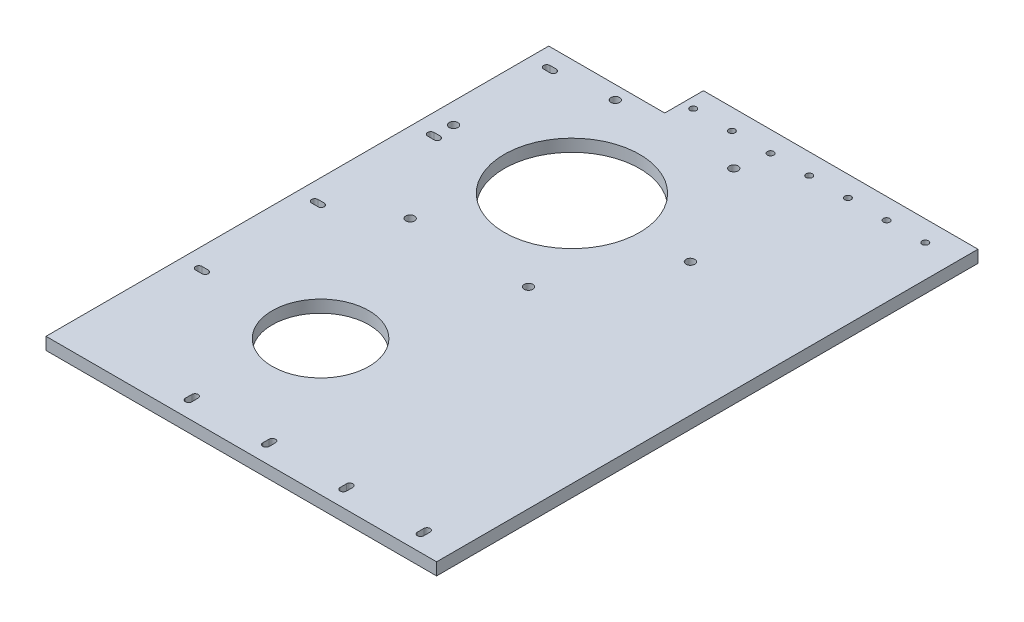
from build123d import *

# Parameters (mm, degrees)
BOSS_EXTRUDE1_DEPTH = 6.35
SKETCH9_R           = 1.65
CUT_EXTRUDE10_DEPTH = 30
CUT_EXTRUDE12_DEPTH = 30
CUT_EXTRUDE13_DEPTH = 10
SKETCH12_R          = 35
CUT_EXTRUDE14_DEPTH = 192.836707905
SKETCH13_R          = 2.25
CUT_EXTRUDE15_DEPTH = 192.836707905
SKETCH14_R          = 25
CUT_EXTRUDE16_DEPTH = 10


with BuildPart() as part:
    # Sketch1 → Boss-Extrude1 (new body)
    with BuildSketch(Plane(origin=(0, 0, 0), x_dir=(1, 0, 0), z_dir=(0, 1, 0))):
        Polygon((-71, 140), (71, 140), (71, -140), (-131, -140), (-131, 120), (-71, 120), align=None)
    extrude(amount=BOSS_EXTRUDE1_DEPTH)

    # Sketch9 → Cut-Extrude10 (cut)
    with BuildSketch(Plane(origin=(0, 0, 0), x_dir=(-1, 0, 0), z_dir=(0, -1, 0))):
        with Locations((45.6, 129.325)):
            Circle(SKETCH9_R)
        with Locations((5.6, 129.325)):
            Circle(SKETCH9_R)
        with Locations((-34.4, 129.325)):
            Circle(SKETCH9_R)
        with Locations((65.6, 129.325)):
            Circle(SKETCH9_R)
        with Locations((25.6, 129.325)):
            Circle(SKETCH9_R)
        with Locations((-14.4, 129.325)):
            Circle(SKETCH9_R)
        with Locations((-54.4, 129.325)):
            Circle(SKETCH9_R)
    extrude(amount=-CUT_EXTRUDE10_DEPTH, mode=Mode.SUBTRACT)

    # Sketch11 → Cut-Extrude12 (cut)
    with BuildSketch(Plane(origin=(0, 6.35, 0), x_dir=(1, 0, 0), z_dir=(0, 1, 0))):
        with BuildLine():
            Line((-63.95, -128.355), (-63.95, -131.655))
            ThreePointArc((-63.95, -131.655), (-65.6, -133.305), (-67.25, -131.655))
            Line((-67.25, -131.655), (-67.25, -128.355))
            ThreePointArc((-67.25, -128.355), (-65.6, -126.705), (-63.95, -128.355))
        make_face()
        with BuildLine():
            Line((-23.95, -128.353535871), (-23.95, -131.653535871))
            ThreePointArc((-23.95, -131.653535871), (-25.6, -133.303535871), (-27.25, -131.653535871))
            Line((-27.25, -131.653535871), (-27.25, -128.353535871))
            ThreePointArc((-27.25, -128.353535871), (-25.6, -126.703535871), (-23.95, -128.353535871))
        make_face()
        with BuildLine():
            Line((16.05, -128.352071742), (16.05, -131.652071742))
            ThreePointArc((16.05, -131.652071742), (14.4, -133.302071742), (12.75, -131.652071742))
            Line((12.75, -131.652071742), (12.75, -128.352071742))
            ThreePointArc((12.75, -128.352071742), (14.4, -126.702071742), (16.05, -128.352071742))
        make_face()
        with BuildLine():
            Line((56.05, -128.350607613), (56.05, -131.650607613))
            ThreePointArc((56.05, -131.650607613), (54.4, -133.300607613), (52.75, -131.650607613))
            Line((52.75, -131.650607613), (52.75, -128.350607613))
            ThreePointArc((52.75, -128.350607613), (54.4, -126.700607613), (56.05, -128.350607613))
        make_face()
    extrude(amount=-CUT_EXTRUDE12_DEPTH, mode=Mode.SUBTRACT)

    # Sketch10 → Cut-Extrude13 (cut)
    with BuildSketch(Plane.XZ):
        with BuildLine():
            ThreePointArc((-121.975, 11.65), (-123.625, 10), (-121.975, 8.35))
            Line((-121.975, 8.35), (-118.675, 8.35))
            ThreePointArc((-118.675, 8.35), (-117.025, 10), (-118.675, 11.65))
            Line((-118.675, 11.65), (-121.975, 11.65))
        make_face()
        with BuildLine():
            ThreePointArc((-121.975, 71.65), (-123.625, 70), (-121.975, 68.35))
            Line((-121.975, 68.35), (-118.675, 68.35))
            ThreePointArc((-118.675, 68.35), (-117.025, 70), (-118.675, 71.65))
            Line((-118.675, 71.65), (-121.975, 71.65))
        make_face()
        with BuildLine():
            ThreePointArc((-121.975, -48.35), (-123.625, -50), (-121.975, -51.65))
            Line((-121.975, -51.65), (-118.675, -51.65))
            ThreePointArc((-118.675, -51.65), (-117.025, -50), (-118.675, -48.35))
            Line((-118.675, -48.35), (-121.975, -48.35))
        make_face()
        with BuildLine():
            ThreePointArc((-121.975, -108.35), (-123.625, -110), (-121.975, -111.65))
            Line((-121.975, -111.65), (-118.675, -111.65))
            ThreePointArc((-118.675, -111.65), (-117.025, -110), (-118.675, -108.35))
            Line((-118.675, -108.35), (-121.975, -108.35))
        make_face()
    extrude(amount=-CUT_EXTRUDE13_DEPTH, mode=Mode.SUBTRACT)

    # Sketch12 → Cut-Extrude14 (cut, through all)
    with BuildSketch(Plane(origin=(0, 6.35, 0), x_dir=(1, 0, 0), z_dir=(0, 1, 0))):
        with Locations((-59, 60)):
            Circle(SKETCH12_R)
    extrude(amount=-CUT_EXTRUDE14_DEPTH, mode=Mode.SUBTRACT)

    # Sketch13 → Cut-Extrude15 (cut, through all)
    with BuildSketch(Plane(origin=(0, 6.35, 0), x_dir=(1, 0, 0), z_dir=(0, 1, 0))):
        with Locations((-120.25, 60)):
            Circle(SKETCH13_R)
        with Locations((-89.625, 113.044055982)):
            Circle(SKETCH13_R)
        with Locations((-28.375, 113.044055982)):
            Circle(SKETCH13_R)
        with Locations((2.25, 60)):
            Circle(SKETCH13_R)
        with Locations((-28.375, 6.955944018)):
            Circle(SKETCH13_R)
        with Locations((-89.625, 6.955944018)):
            Circle(SKETCH13_R)
    extrude(amount=-CUT_EXTRUDE15_DEPTH, mode=Mode.SUBTRACT)

    # Sketch14 → Cut-Extrude16 (cut)
    with BuildSketch(Plane(origin=(0, 6.35, 0), x_dir=(1, 0, 0), z_dir=(0, 1, 0))):
        with Locations((-59, -70)):
            Circle(SKETCH14_R)
    extrude(amount=-CUT_EXTRUDE16_DEPTH, mode=Mode.SUBTRACT)


solid = part.part
